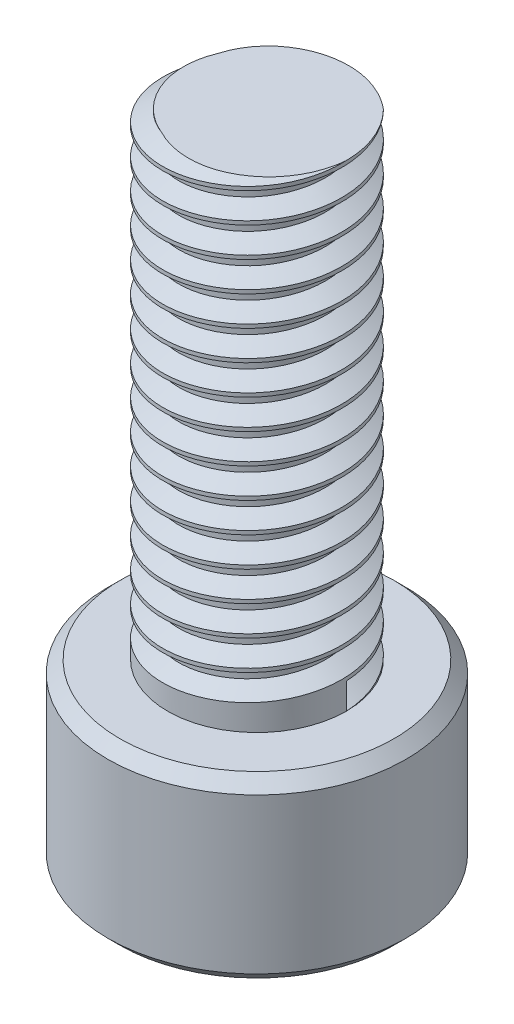
from build123d import *
from build123d.topology import SkipClean

# Parameters (mm, degrees)
SKETCH1_R           = 2.5
BOSS_EXTRUDE1_DEPTH = 3
CUT_EXTRUDE1_DEPTH  = 2
CHAMFER1_SIZE       = 0.2
SKETCH3_R           = 1.5
BOSS_EXTRUDE2_DEPTH = 8
THREAD1_PITCH       = 0.5


with BuildPart() as part:
    # Sketch1 → Boss-Extrude1 (new body)
    with BuildSketch(Plane(origin=(0, 0, 0), x_dir=(1, 0, 0), z_dir=(0, 1, 0))):
        with Locations(Location((0, 0, 0), (0, 0, 270))):
            Circle(SKETCH1_R)
    extrude(amount=-BOSS_EXTRUDE1_DEPTH)

    # Sketch2 → Cut-Extrude1 (cut)
    with BuildSketch(Plane.XZ.offset(3)):
        Polygon((1.732050808, 0), (0.866025404, 1.5), (-0.866025404, 1.5), (-1.732050808, 0), (-0.866025404, -1.5), (0.866025404, -1.5), align=None)
    extrude(amount=-CUT_EXTRUDE1_DEPTH, mode=Mode.SUBTRACT)

    # Chamfer1
    chamfer1_edges = [part.edges().sort_by_distance(p)[0] for p in [
        (1.299038106, -3, -0.75),
        (1.299038106, -3, 0.75),
        (0, -3, 1.5),
        (-1.299038106, -3, 0.75),
        (-1.299038106, -3, -0.75),
        (0, -3, -1.5),
        (0, 0, -2.5),
        (0, -3, -2.5),
    ]]
    chamfer(chamfer1_edges, length=CHAMFER1_SIZE)

    # Sketch3 → Boss-Extrude2 (add)
    with BuildSketch(Plane(origin=(0, 0, 0), x_dir=(1, 0, 0), z_dir=(0, 1, 0))):
        with Locations(Location((0, 0, 0), (0, 0, 270))):
            Circle(SKETCH3_R)
    extrude(amount=BOSS_EXTRUDE2_DEPTH)

    # Thread1: the profile of Thread Profile1 profile screwed along a right-hand helix of 80 turns, 6 arcs to a turn; built about Z, then put on its axis
    with SkipClean():  # the faces are left unmerged after this step: merging them gives an invalid solid
        thread1_z = Axis((0, 0, 0), (0, 0, 1))
        thread1_corners = [(1.5003, 0, -0.000173205), (1.5003, 0, 0.437673204), (1.229367063, 0, 0.281249999), (1.229367063, 0, 0.156249999)]
        with BuildLine(mode=Mode.PRIVATE) as thread1_profile:
            Line(thread1_corners[0], thread1_corners[1])
            Line(thread1_corners[1], thread1_corners[2])
            Line(thread1_corners[2], thread1_corners[3])
            Line(thread1_corners[3], thread1_corners[0])
        thread1_cap = Face(thread1_profile.wire())
        thread1_turn_angles = [0, 30, 60, 90, 120, 150, 180, 210, 240, 270, 300, 330, 360]
        thread1_turn_weights = [1, 0.8660254037844387, 1, 0.8660254037844387, 1, 0.8660254037844387, 1, 0.8660254037844387, 1, 0.8660254037844387, 1, 0.8660254037844387, 1]
        thread1_turn_rails = [Edge.make_bspline([Vector(p[0], p[1], 0).rotate(thread1_z, thread1_turn_angles[k]) / thread1_turn_weights[k] + Vector(0, 0, p[2] + THREAD1_PITCH * thread1_turn_angles[k] / 360) for k in range(13)], [0, 0, 0, 1, 1, 2, 2, 3, 3, 4, 4, 5, 5, 6, 6, 6], 2, thread1_turn_weights) for p in thread1_corners]
        thread1_turn_sides = [Face.make_surface_from_curves(thread1_turn_rails[p[0]], thread1_turn_rails[p[1]]) for p in [(0, 1), (1, 2), (2, 3), (3, 0)]]
        thread1_turn = Solid(Shell([*thread1_turn_sides, thread1_cap, thread1_cap.rotate(thread1_z, 360).moved(Location((0, 0, THREAD1_PITCH * 360 / 360)))]))
        thread1_each = [*[thread1_turn.moved(Location((0, 0, THREAD1_PITCH * i))) for i in range(80)]]
        add(Plane(origin=(0, 0, 0), x_dir=(1, 0, 0), z_dir=(0, 1, 0)) * Compound([thread1_each[i] for i in range(0, 80, 2)]), mode=Mode.SUBTRACT)
        add(Plane(origin=(0, 0, 0), x_dir=(1, 0, 0), z_dir=(0, 1, 0)) * Compound([thread1_each[i] for i in range(1, 80, 2)]), mode=Mode.SUBTRACT)


solid = part.part
